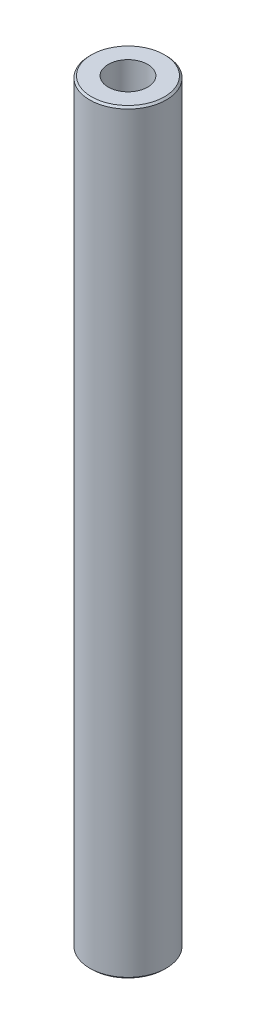
from build123d import *

# Parameters (mm, degrees)
SKETCH1_R           = 7.5
BOSS_EXTRUDE1_DEPTH = 148.099825364
SKETCH2_R           = 3.872103006
CUT_EXTRUDE1_DEPTH  = 149.47915097
CHAMFER1_SIZE       = 0.357468594


with BuildPart() as part:
    # Sketch1 → Boss-Extrude1 (new body)
    with BuildSketch(Plane(origin=(0, 0, 0), x_dir=(1, 0, 0), z_dir=(0, 1, 0))):
        Circle(SKETCH1_R)
    extrude(amount=BOSS_EXTRUDE1_DEPTH)

    # Sketch2 → Cut-Extrude1 (cut, through all)
    with BuildSketch(Plane(origin=(0, 0, 0), x_dir=(1, 0, 0), z_dir=(0, 1, 0))):
        Circle(SKETCH2_R)
    extrude(amount=CUT_EXTRUDE1_DEPTH, mode=Mode.SUBTRACT)

    # Chamfer1
    chamfer1_edges = [part.edges().sort_by_distance(p)[0] for p in [
        (-7.5, 148.099825364, 0),
        (-7.5, 0, 0),
    ]]
    chamfer(chamfer1_edges, length=CHAMFER1_SIZE)


solid = part.part
